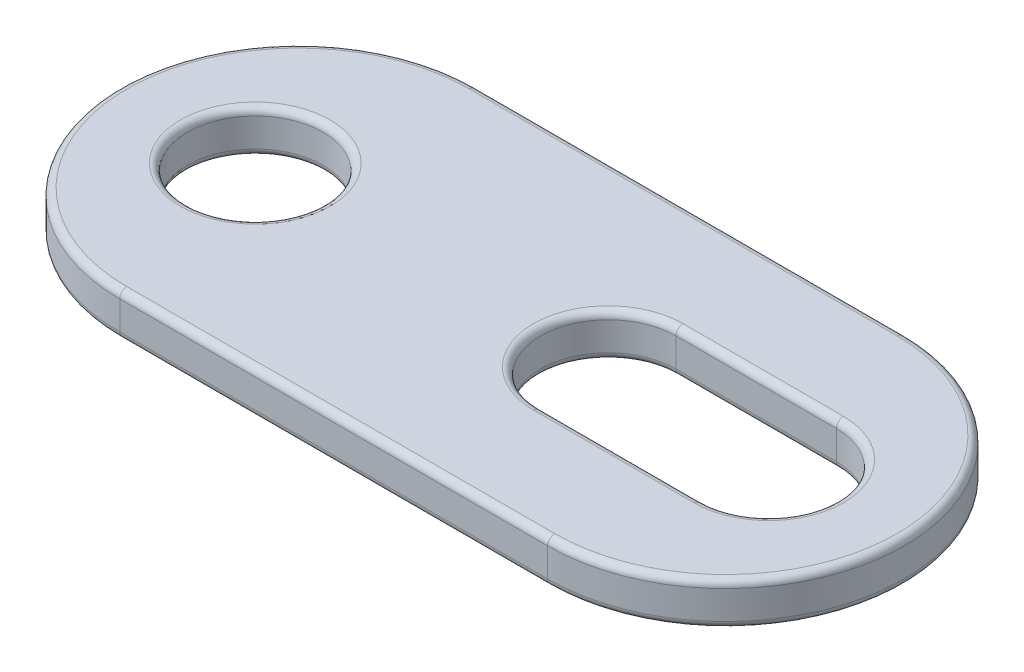
from build123d import *

# Parameters (mm, degrees)
SKETCH1_R          = 2.413
BASE_FLANGE1_DEPTH = 1.524
FILLET2_R          = 0.254


# Sheet-metal steps are written as plain solids
with BuildPart() as part:
    # Sketch1 → Base-Flange1 (new body)
    with BuildSketch(Plane(origin=(0, 0, 0), x_dir=(1, 0, 0), z_dir=(0, 1, 0))):
        with BuildLine():
            Line((0, 0), (15.24, 0))
            ThreePointArc((15.24, 0), (21.59, 6.35), (15.24, 12.7))
            Line((15.24, 12.7), (0, 12.7))
            ThreePointArc((0, 12.7), (-6.35, 6.35), (0, 0))
        make_face()
        with Locations(Location((-1.524, 6.35, 0), (0, 0, 90))):
            Circle(SKETCH1_R, mode=Mode.SUBTRACT)
        with BuildLine():
            Line((11.049, 8.763), (16.764, 8.763))
            ThreePointArc((16.764, 8.763), (19.177, 6.35), (16.764, 3.937))
            Line((16.764, 3.937), (11.049, 3.937))
            ThreePointArc((11.049, 3.937), (8.636, 6.35), (11.049, 8.763))
        make_face(mode=Mode.SUBTRACT)
    extrude(amount=BASE_FLANGE1_DEPTH)

    # Fillet2
    fillet2_edges = [part.edges().sort_by_distance(p)[0] for p in [
        (21.59, 1.524, -6.35),
        (-1.524, 0, -3.937),
        (-1.524, 1.524, -3.937),
        (7.62, 1.524, -12.7),
        (8.636, 0, -6.35),
        (13.9065, 0, -3.937),
        (19.177, 0, -6.35),
        (13.9065, 0, -8.763),
        (8.636, 1.524, -6.35),
        (13.9065, 1.524, -3.937),
        (19.177, 1.524, -6.35),
        (13.9065, 1.524, -8.763),
        (-6.35, 1.524, -6.35),
        (7.62, 0, -12.7),
        (21.59, 0, -6.35),
        (7.62, 0, 0),
        (-6.35, 0, -6.35),
        (7.62, 1.524, 0),
    ]]
    fillet(fillet2_edges, radius=FILLET2_R)


solid = part.part
